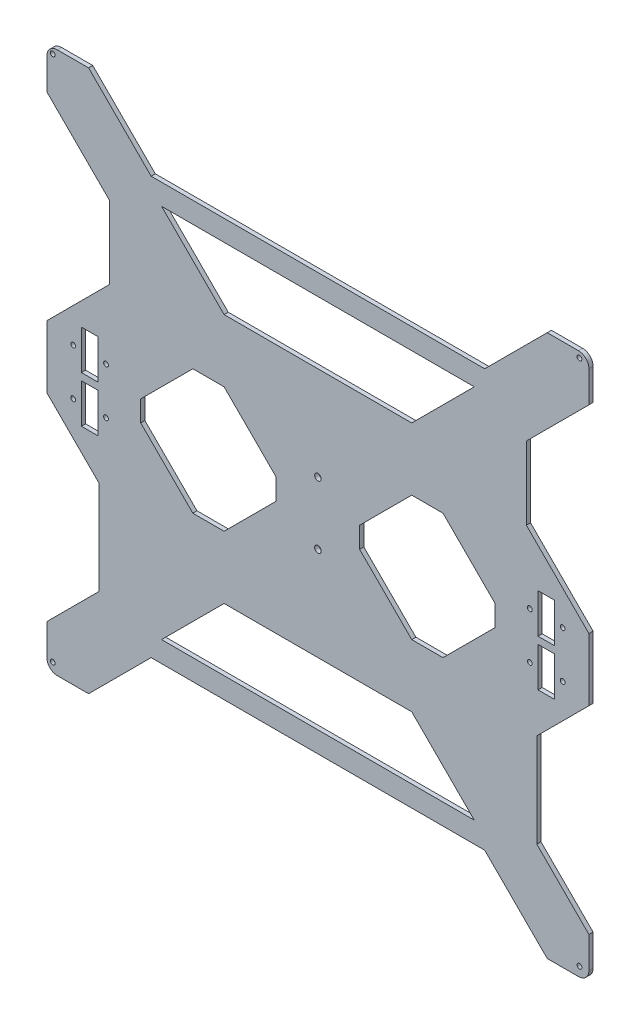
from build123d import *

# Parameters (mm, degrees)
MODEL_R             = 1.4605
MODEL_R_2           = 2
BOSS_EXTRUDE1_DEPTH = 1.27
SKETCH1_W           = 10
SKETCH1_H           = 24
CUT_EXTRUDE1_DEPTH  = 10


with BuildPart() as part:
    # Model → Boss-Extrude1 (new, symmetric)
    with BuildSketch(Plane.XY):
        with BuildLine():
            Line((-290.681304326, 108.4317), (-252.581304326, 70.3317))
            Line((-252.581304326, 70.3317), (-252.581304326, 25.8817))
            Line((-252.581304326, 25.8817), (-290.681304326, -12.2183))
            Line((-290.681304326, -12.2183), (-290.681304326, -50.3183))
            Line((-290.681304326, -50.3183), (-258.931304326, -82.0683))
            Line((-258.931304326, -82.0683), (-258.931304326, -139.2183))
            Line((-258.931304326, -139.2183), (-290.681304326, -170.9683))
            Line((-290.681304326, -170.9683), (-290.681304326, -190.0183))
            ThreePointArc((-290.681304326, -190.0183), (-288.821432386, -194.508428061), (-284.331304326, -196.3683))
            Line((-284.331304326, -196.3683), (-265.281304326, -196.3683))
            Line((-265.281304326, -196.3683), (-227.181304326, -158.2683))
            Line((-227.181304326, -158.2683), (-23.981304326, -158.2683))
            Line((-23.981304326, -158.2683), (14.118695674, -196.3683))
            Line((14.118695674, -196.3683), (33.168695674, -196.3683))
            ThreePointArc((33.168695674, -196.3683), (37.658823735, -194.508428061), (39.518695674, -190.0183))
            Line((39.518695674, -190.0183), (39.518695674, -170.9683))
            Line((39.518695674, -170.9683), (7.768695674, -139.2183))
            Line((7.768695674, -139.2183), (7.768695674, -82.0683))
            Line((7.768695674, -82.0683), (22.457936385, -67.37905929))
            Line((22.457936385, -67.37905929), (39.518695674, -50.3183))
            Line((39.518695674, -50.3183), (39.518695674, -12.2183))
            Line((39.518695674, -12.2183), (1.418695674, 25.8817))
            Line((1.418695674, 25.8817), (1.418695674, 70.3317))
            Line((1.418695674, 70.3317), (39.518695674, 108.4317))
            Line((39.518695674, 108.4317), (39.518695674, 127.4817))
            ThreePointArc((39.518695674, 127.4817), (37.658823735, 131.971828061), (33.168695674, 133.8317))
            Line((33.168695674, 133.8317), (14.118695674, 133.8317))
            Line((14.118695674, 133.8317), (-23.981304326, 95.7317))
            Line((-23.981304326, 95.7317), (-227.181304326, 95.7317))
            Line((-227.181304326, 95.7317), (-265.281304326, 133.8317))
            Line((-265.281304326, 133.8317), (-284.331304326, 133.8317))
            ThreePointArc((-284.331304326, 133.8317), (-288.821432386, 131.971828061), (-290.681304326, 127.4817))
            Line((-290.681304326, 127.4817), (-290.681304326, 108.4317))
        make_face()
        with Locations((-287.125304326, -190.6025)):
            Circle(MODEL_R, mode=Mode.SUBTRACT)
        with Locations((-274.681304256, -45.4288)):
            Circle(MODEL_R, mode=Mode.SUBTRACT)
        with Locations((-254.681304256, -45.4288)):
            Circle(MODEL_R, mode=Mode.SUBTRACT)
        Polygon((-68.431304326, -107.4683), (-30.331304326, -145.5683), (-220.831304326, -145.5683), (-182.731304326, -107.4683), align=None, mode=Mode.SUBTRACT)
        with Locations((33.752895674, -190.6025)):
            Circle(MODEL_R, mode=Mode.SUBTRACT)
        with Locations((-125.581304326, -50.3183)):
            Circle(MODEL_R_2, mode=Mode.SUBTRACT)
        Polygon((-68.431304326, -69.3683), (-100.181304326, -37.6183), (-100.181304326, -24.9183), (-68.431304326, 6.8317), (-49.381304326, 6.8317), (-17.631304326, -24.9183), (-17.631304326, -37.6183), (-49.381304326, -69.3683), align=None, mode=Mode.SUBTRACT)
        with Locations((3.518695604, -45.4288)):
            Circle(MODEL_R, mode=Mode.SUBTRACT)
        with Locations((23.518695604, -45.4288)):
            Circle(MODEL_R, mode=Mode.SUBTRACT)
        with Locations((-274.681304256, -17.1078)):
            Circle(MODEL_R, mode=Mode.SUBTRACT)
        with Locations((-254.681304256, -17.1078)):
            Circle(MODEL_R, mode=Mode.SUBTRACT)
        Polygon((-182.731304326, -69.3683), (-201.781304326, -69.3683), (-233.531304326, -37.6183), (-233.531304326, -24.9183), (-201.781304326, 6.8317), (-182.731304326, 6.8317), (-150.981304326, -24.9183), (-150.981304326, -37.6183), align=None, mode=Mode.SUBTRACT)
        with Locations((-287.125304326, 130.2757)):
            Circle(MODEL_R, mode=Mode.SUBTRACT)
        with Locations((-125.581304326, -12.2183)):
            Circle(MODEL_R_2, mode=Mode.SUBTRACT)
        with Locations((3.518695604, -17.1078)):
            Circle(MODEL_R, mode=Mode.SUBTRACT)
        with Locations((23.518695604, -17.1078)):
            Circle(MODEL_R, mode=Mode.SUBTRACT)
        Polygon((-182.731304326, 44.9317), (-220.831304326, 83.0317), (-30.331304326, 83.0317), (-68.431304326, 44.9317), align=None, mode=Mode.SUBTRACT)
        with Locations((33.752895674, 130.2757)):
            Circle(MODEL_R, mode=Mode.SUBTRACT)
    extrude(amount=BOSS_EXTRUDE1_DEPTH, both=True)

    # Sketch1 → Cut-Extrude1 (cut)
    with BuildSketch(Plane.XY.offset(1.27)):
        with Locations((-264.681304256, -45.4288)):
            Rectangle(SKETCH1_W, SKETCH1_H)
        with Locations((-264.681304256, -17.1078)):
            Rectangle(SKETCH1_W, SKETCH1_H)
        with Locations((13.518695604, -17.1078)):
            Rectangle(SKETCH1_W, SKETCH1_H)
        with Locations((13.518695604, -45.4288)):
            Rectangle(SKETCH1_W, SKETCH1_H)
    extrude(amount=-CUT_EXTRUDE1_DEPTH, mode=Mode.SUBTRACT)


solid = part.part
